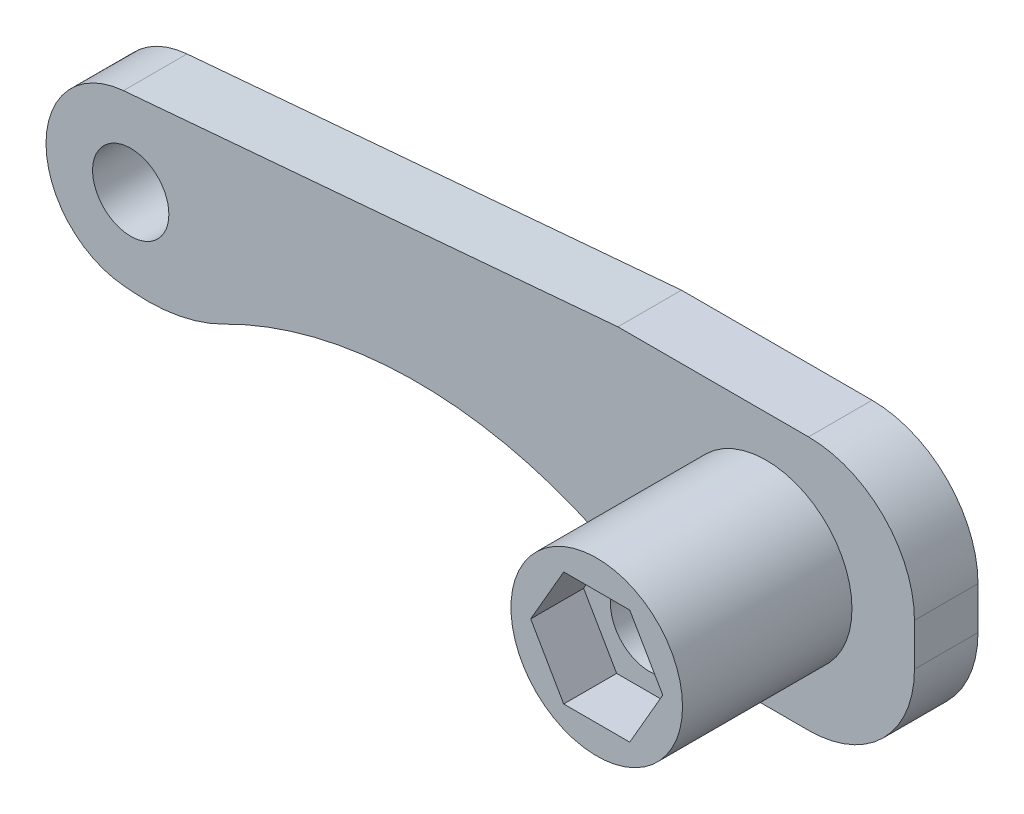
from build123d import *

# Parameters (mm, degrees)
SKETCH1_R               = 1.8
SKETCH1_R_2             = 4.05
BOSS_EXTRUDE1_DEPTH     = 3
SKETCH1_2_R             = 4.05
BOSS_EXTRUDE2_DEPTH     = 11
FILLET1_R               = 5
SKETCH2_R               = 1.85
CUT_EXTRUDE1_DEPTH      = 37.235341864
CUT_EXTRUDE2_DEPTH      = 2.5
CUT_EXTRUDE3_DEPTH      = 36.440090293
CUT_EXTRUDE3_DEPTH_BACK = 36.440090293
FILLET2_R               = 8


with BuildPart() as part:
    # Sketch1 → Boss-Extrude1 (new body)
    with BuildSketch(Plane.XY):
        with BuildLine():
            Line((-30.343961021, -3.985183912), (-7, -6))
            Line((-7, -6), (7, -6))
            Line((7, -6), (7, 6))
            Line((7, 6), (-7, 6))
            Line((-7, 6), (-30.343961021, 3.985183912))
            ThreePointArc((-30.343961021, 3.985183912), (-34, 0), (-30.343961021, -3.985183912))
        make_face()
        with Locations((-30, 0)):
            Circle(SKETCH1_R, mode=Mode.SUBTRACT)
        Circle(SKETCH1_R_2, mode=Mode.SUBTRACT)
    extrude(amount=BOSS_EXTRUDE1_DEPTH)

    # Sketch1<2> → Boss-Extrude2 (add)
    with BuildSketch(Plane.XY):
        Circle(SKETCH1_2_R)
    extrude(amount=BOSS_EXTRUDE2_DEPTH)

    # Fillet1
    fillet1_edges = [part.edges().sort_by_distance(p)[0] for p in [
        (7, -6, 1.5),
        (7, 6, 1.5),
    ]]
    fillet(fillet1_edges, radius=FILLET1_R)

    # Sketch2 → Cut-Extrude1 (cut, through all)
    with BuildSketch(Plane(origin=(0, 0, 0), x_dir=(-1, 0, 0), z_dir=(0, 0, -1))):
        Circle(SKETCH2_R)
    extrude(amount=-CUT_EXTRUDE1_DEPTH, mode=Mode.SUBTRACT)

    # Sketch3 → Cut-Extrude2 (cut)
    with BuildSketch(Plane.XY.offset(11)):
        Polygon((1.558845727, 2.7), (-1.558845727, 2.7), (-3.117691454, 0), (-1.558845727, -2.7), (1.558845727, -2.7), (3.117691454, 0), align=None)
    extrude(amount=-CUT_EXTRUDE2_DEPTH, mode=Mode.SUBTRACT)

    # Sketch5 → Cut-Extrude3 (cut, two sides: drawn at the far end of the back side and taken through both)
    with BuildSketch(Plane.XY.offset(3).offset(-CUT_EXTRUDE3_DEPTH_BACK)):
        with BuildLine():
            Line((-27.410855082, -4.238340137), (-7, -6))
            Line((-7, -6), (-3.277962863, -6))
            Line((-3.277962863, -6), (-3.271243445, -6))
            ThreePointArc((-3.271243445, -6), (-15.044311785, -1.053046052), (-27.410855082, -4.238340137))
        make_face()
    extrude(amount=CUT_EXTRUDE3_DEPTH + CUT_EXTRUDE3_DEPTH_BACK, mode=Mode.SUBTRACT)

    # Fillet2
    fillet2_edges = [part.edges().sort_by_distance(p)[0] for p in [
        (-3.271243445, -6, 1.5),
        (-27.410855082, -4.238340137, 1.5),
    ]]
    fillet(fillet2_edges, radius=FILLET2_R)


solid = part.part
